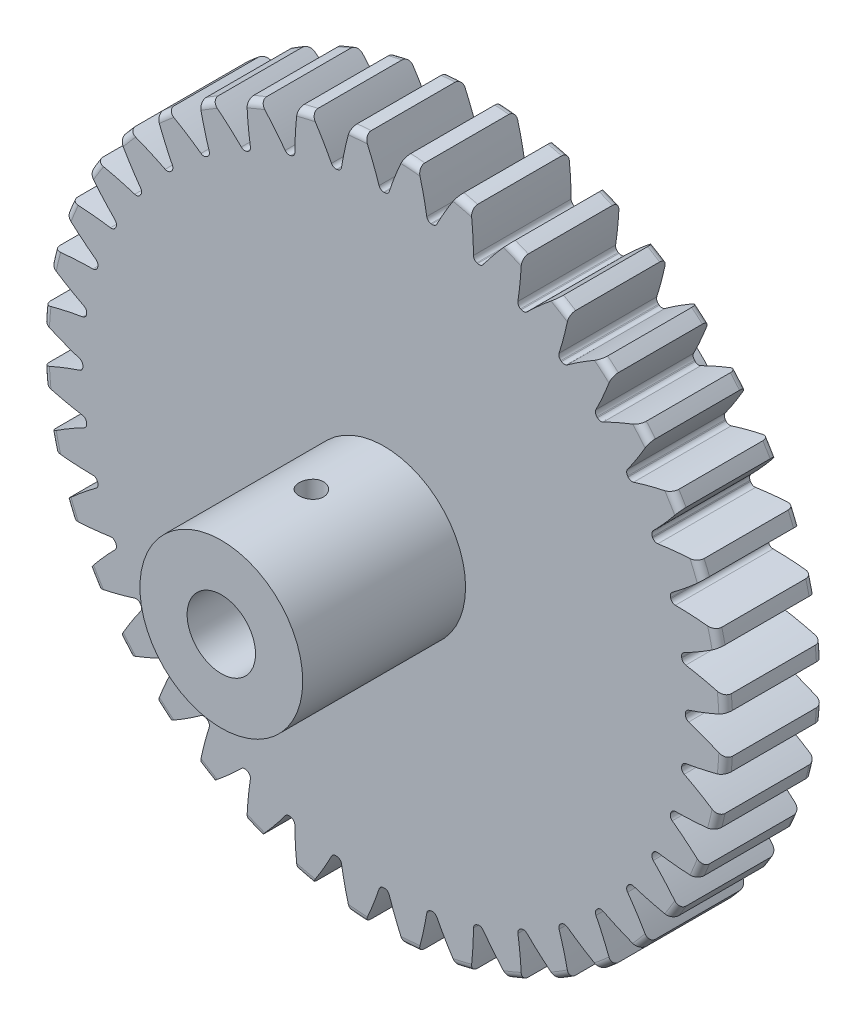
from build123d import *

# Parameters (mm, degrees)
FILLET2_R                = 0.42
CUT_EXTRUDE2_DEPTH       = 31.298514884
CIRPATTERN1_COUNT        = 40
CUT_EXTRUDE3_REACH       = 32.25
SKETCH9_R                = 8.42
SKETCH9_R_2              = 5.000000033
BOSS_EXTRUDE1_START      = -6
SKETCH9_2_R              = 8.42
SKETCH9_2_R_2            = 5.000000033
SKETCH9_2_R_3            = 2.099999991
BOSS_EXTRUDE1_DEPTH      = 6
BOSS_EXTRUDE2_DEPTH      = 10
BOSS_EXTRUDE2_DEPTH_BACK = 16
SKETCH9_4_R              = 5.000000033
SKETCH9_4_R_2            = 2.099999991
SKETCH11_R               = 0.750000024
CUT_EXTRUDE4_DEPTH       = 38.009242446


with BuildPart() as part:
    # Sketch4 → Revolve1 (revolve)
    with BuildSketch(Plane(origin=(0, 0, 0), x_dir=(0, 0, -1), z_dir=(1, 0, 0))):
        Polygon((-12, 4), (-12, 8), (-6, 8), (-6, 21), (0, 21), (0, 4), align=None)
    revolve(axis=Axis((0, 0, 6), (0, 0, 1)))

    # Fillet2
    fillet2_edges = [part.edges().sort_by_distance(p)[0] for p in [
        (0, -21, 0),
        (0, -21, 6),
        (0, -8, 6),
        (0, -8, 12),
    ]]
    fillet(fillet2_edges, radius=FILLET2_R)

    # Sketch7 → Cut-Extrude2 (cut, through all)
    with BuildSketch(Plane.XY.offset(6)):
        with BuildLine():
            ThreePointArc((-0.026958983, 18.499980357), (0, 18.5), (0.026958983, 18.499980357))
            ThreePointArc((0.026958983, 18.499980357), (0.202840783, 18.556625013), (0.312174396, 18.705585364))
            ThreePointArc((0.312174396, 18.705585364), (0.730273565, 19.848918998), (1.21715964, 20.96469705))
            ThreePointArc((1.21715964, 20.96469705), (0, 21), (-1.21715964, 20.96469705))
            ThreePointArc((-1.21715964, 20.96469705), (-0.730273565, 19.848918998), (-0.312174396, 18.705585364))
            ThreePointArc((-0.312174396, 18.705585364), (-0.202840783, 18.556625013), (-0.026958983, 18.499980357))
        make_face()
    cut_extrude2 = extrude(amount=-CUT_EXTRUDE2_DEPTH, mode=Mode.SUBTRACT)

    # CirPattern1: Cut-Extrude2 ×40 about axis
    cirpattern1_axis = Axis((0, 0, 0), (0, 0, 1))
    for i in range(1, CIRPATTERN1_COUNT):
        add(cut_extrude2.rotate(cirpattern1_axis, i * 360 / CIRPATTERN1_COUNT), mode=Mode.SUBTRACT)

    # Sketch9 → Cut-Extrude3 (cut, up to next)
    with BuildSketch(Plane.XY.offset(6), mode=Mode.PRIVATE) as cut_extrude3_sk1:
        Circle(SKETCH9_R)
        with Locations(Location((0, 0, 0), (0, 0, 270))):
            Circle(SKETCH9_R_2, mode=Mode.SUBTRACT)
    cut_extrude3_tool1 = extrude(cut_extrude3_sk1.sketch, amount=CUT_EXTRUDE3_REACH, mode=Mode.PRIVATE) & part.part
    add(cut_extrude3_tool1.solids().sort_by_distance((-8.181846, 0, 6))[0], mode=Mode.SUBTRACT)

    # Sketch9<2> → Boss-Extrude1 (add)
    # profile 1 of 2: a face of its own
    with BuildSketch(Plane.XY.offset(6).offset(BOSS_EXTRUDE1_START)):
        Circle(SKETCH9_2_R)
        with Locations(Location((0, 0, 0), (0, 0, 270))):
            Circle(SKETCH9_2_R_2, mode=Mode.SUBTRACT)
    # profile 2 of 2: a face of its own
    with BuildSketch(Plane.XY.offset(6).offset(BOSS_EXTRUDE1_START)):
        with Locations(Location((0, 0, 0), (0, 0, 270))):
            Circle(SKETCH9_2_R_2)
        Circle(SKETCH9_2_R_3, mode=Mode.SUBTRACT)
    extrude(amount=BOSS_EXTRUDE1_DEPTH)

    # Sketch9<4> → Boss-Extrude2 (add, two sides: drawn at the far end of the back side and taken through both)
    with BuildSketch(Plane.XY.offset(6).offset(-BOSS_EXTRUDE2_DEPTH_BACK)):
        Circle(SKETCH9_4_R)
        Circle(SKETCH9_4_R_2, mode=Mode.SUBTRACT)
    extrude(amount=BOSS_EXTRUDE2_DEPTH + BOSS_EXTRUDE2_DEPTH_BACK)

    # Sketch11 → Cut-Extrude4 (cut, through all)
    with BuildSketch(Plane(origin=(0, 5.000000033, 0), x_dir=(1, 0, 0), z_dir=(0, 1, 0))):
        with Locations(Location((0.026958983, -10.499999986, 0), (0, 0, 270))):
            Circle(SKETCH11_R)
        with Locations(Location((0.026958983, 4.499999986, 0), (0, 0, 270))):
            Circle(SKETCH11_R)
    extrude(amount=-CUT_EXTRUDE4_DEPTH, mode=Mode.SUBTRACT)


solid = part.part
